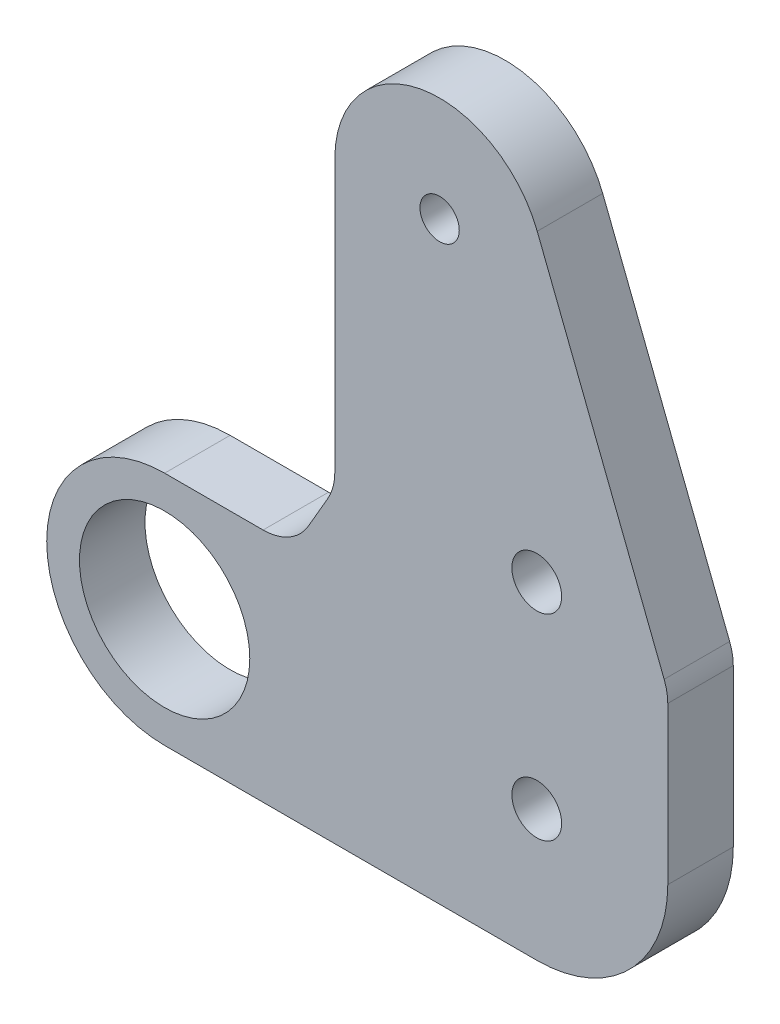
from build123d import *

# Parameters (mm, degrees)
EXTRUDE_1_OUTLINE_R   = 5
EXTRUDE_1_OUTLINE_R_2 = 1.9
EXTRUDE_1_OUTLINE_R_3 = 1.5
EXTRUDE_1_DEPTH       = 5
SKETCH_2_R            = 6.5
CUT_EXTRUDE_1_DEPTH   = 59.840235174


# Read off the part's stored shape, not the designer's step: 凸台-拉伸1
with BuildPart() as part:
    # 凸台-拉伸1 outline → 凸台-拉伸1 (new body)
    with BuildSketch(Plane.XY):
        with BuildLine():
            ThreePointArc((0, 9), (-8.999999903, -0.001320394), (0.002640787, -8.999999613))
            Line((0.002640787, -8.999999613), (28.4053363, -8.999999613))
            ThreePointArc((28.4053363, -8.999999613), (35.476644301, -6.070827227), (38.405336277, 1.000679757))
            Line((38.405336277, 1.000679757), (38.404522272, 12.982447292))
            ThreePointArc((38.404522272, 12.982447292), (38.33518919, 13.723699418), (38.129692452, 14.439264147))
            Line((38.129692452, 14.439264147), (28.440328317, 39.210942539))
            ThreePointArc((28.440328317, 39.210942539), (19.507207266, 44.158149523), (12.989987975, 36.296765334))
            Line((12.989987975, 36.296765334), (12.989987975, 15.549905346))
            ThreePointArc((12.989987975, 15.549905346), (12.853385476, 14.513488564), (12.452908102, 13.547860343))
            Line((12.452908102, 13.547860343), (10.978711226, 10.997954609))
            ThreePointArc((10.978711226, 10.997954609), (9.514768336, 9.535307706), (7.515791099, 8.999999613))
            Line((7.515791099, 8.999999613), (0, 9))
        make_face()
        Circle(EXTRUDE_1_OUTLINE_R, mode=Mode.SUBTRACT)
        with Locations((28.405336318, 0.999728686)):
            Circle(EXTRUDE_1_OUTLINE_R_2, mode=Mode.SUBTRACT)
        with Locations((28.405336318, 15.999728686)):
            Circle(EXTRUDE_1_OUTLINE_R_2, mode=Mode.SUBTRACT)
        with Locations((20.989987975, 36.296765334)):
            Circle(EXTRUDE_1_OUTLINE_R_3, mode=Mode.SUBTRACT)
    extrude(amount=EXTRUDE_1_DEPTH)

    # 草图2 → 切除-拉伸1 (cut, through all)
    with BuildSketch(Plane.XY.offset(5)):
        Circle(SKETCH_2_R)
    extrude(amount=-CUT_EXTRUDE_1_DEPTH, mode=Mode.SUBTRACT)


solid = part.part
